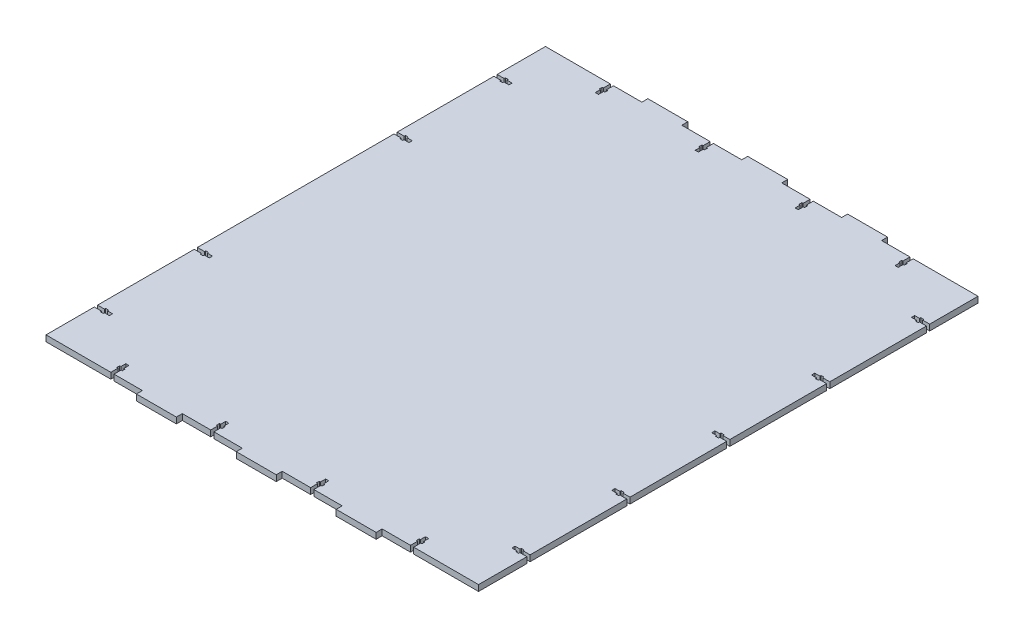
from build123d import *

# Parameters (mm, degrees)
SKETCH1_W           = 433
SKETCH1_H           = 500
BOSS_EXTRUDE1_DEPTH = 6
SKETCH2_W           = 40
SKETCH2_H           = 6
BOSS_EXTRUDE2_DEPTH = 6
CUT_EXTRUDE1_DEPTH  = 336.327079133


with BuildPart() as part:
    # Sketch1 → Boss-Extrude1 (new body)
    with BuildSketch(Plane(origin=(0, 0, 0), x_dir=(1, 0, 0), z_dir=(0, 1, 0))):
        Rectangle(SKETCH1_W, SKETCH1_H)
    extrude(amount=BOSS_EXTRUDE1_DEPTH)

    # Sketch2 → Boss-Extrude2 (add)
    with BuildSketch(Plane.XZ):
        with Locations((-100, 253)):
            Rectangle(SKETCH2_W, SKETCH2_H)
        with Locations((0, 253)):
            Rectangle(SKETCH2_W, SKETCH2_H)
        with Locations((100, 253)):
            Rectangle(SKETCH2_W, SKETCH2_H)
        with Locations((100, -253)):
            Rectangle(SKETCH2_W, SKETCH2_H)
        with Locations((0, -253)):
            Rectangle(SKETCH2_W, SKETCH2_H)
        with Locations((-100, -253)):
            Rectangle(SKETCH2_W, SKETCH2_H)
    extrude(amount=-BOSS_EXTRUDE2_DEPTH)

    # Sketch3 → Cut-Extrude1 (cut, through all)
    with BuildSketch(Plane.XZ):
        Polygon((-151.6, -243), (-151.6, -250), (-148.4, -250), (-148.4, -243), (-147.2, -243), (-147.2, -240), (-148.4, -240), (-148.4, -235), (-151.6, -235), (-151.6, -240), (-152.8, -240), (-152.8, -243), align=None)
        Polygon((-148.4, 250), (-151.6, 250), (-151.6, 243), (-152.8, 243), (-152.8, 240), (-151.6, 240), (-151.6, 235), (-148.4, 235), (-148.4, 240), (-147.2, 240), (-147.2, 243), (-148.4, 243), align=None)
        Polygon((-216.5, 201.6), (-216.5, 198.4), (-209.5, 198.4), (-209.5, 197.2), (-206.5, 197.2), (-206.5, 198.4), (-201.5, 198.4), (-201.5, 201.6), (-206.5, 201.6), (-206.5, 202.8), (-209.5, 202.8), (-209.5, 201.6), align=None)
        Polygon((-216.5, 101.6), (-216.5, 98.4), (-209.5, 98.4), (-209.5, 97.2), (-206.5, 97.2), (-206.5, 98.4), (-201.5, 98.4), (-201.5, 101.6), (-206.5, 101.6), (-206.5, 102.8), (-209.5, 102.8), (-209.5, 101.6), align=None)
        Polygon((-216.5, -98.4), (-216.5, -101.6), (-209.5, -101.6), (-209.5, -102.8), (-206.5, -102.8), (-206.5, -101.6), (-201.5, -101.6), (-201.5, -98.4), (-206.5, -98.4), (-206.5, -97.2), (-209.5, -97.2), (-209.5, -98.4), align=None)
        Polygon((-206.5, -201.6), (-201.5, -201.6), (-201.5, -198.4), (-206.5, -198.4), (-206.5, -197.2), (-209.5, -197.2), (-209.5, -198.4), (-216.5, -198.4), (-216.5, -201.6), (-209.5, -201.6), (-209.5, -202.8), (-206.5, -202.8), align=None)
        Polygon((151.6, 243), (151.6, 250), (148.4, 250), (148.4, 243), (147.2, 243), (147.2, 240), (148.4, 240), (148.4, 235), (151.6, 235), (151.6, 240), (152.8, 240), (152.8, 243), align=None)
        Polygon((148.4, -250), (151.6, -250), (151.6, -243), (152.8, -243), (152.8, -240), (151.6, -240), (151.6, -235), (148.4, -235), (148.4, -240), (147.2, -240), (147.2, -243), (148.4, -243), align=None)
        Polygon((216.5, -201.6), (216.5, -198.4), (209.5, -198.4), (209.5, -197.2), (206.5, -197.2), (206.5, -198.4), (201.5, -198.4), (201.5, -201.6), (206.5, -201.6), (206.5, -202.8), (209.5, -202.8), (209.5, -201.6), align=None)
        Polygon((216.5, -101.6), (216.5, -98.4), (209.5, -98.4), (209.5, -97.2), (206.5, -97.2), (206.5, -98.4), (201.5, -98.4), (201.5, -101.6), (206.5, -101.6), (206.5, -102.8), (209.5, -102.8), (209.5, -101.6), align=None)
        Polygon((216.5, -1.6), (216.5, 1.6), (209.5, 1.6), (209.5, 2.8), (206.5, 2.8), (206.5, 1.6), (201.5, 1.6), (201.5, -1.6), (206.5, -1.6), (206.5, -2.8), (209.5, -2.8), (209.5, -1.6), align=None)
        Polygon((216.5, 98.4), (216.5, 101.6), (209.5, 101.6), (209.5, 102.8), (206.5, 102.8), (206.5, 101.6), (201.5, 101.6), (201.5, 98.4), (206.5, 98.4), (206.5, 97.2), (209.5, 97.2), (209.5, 98.4), align=None)
        Polygon((206.5, 202.8), (206.5, 201.6), (201.5, 201.6), (201.5, 198.4), (206.5, 198.4), (206.5, 197.2), (209.5, 197.2), (209.5, 198.4), (216.5, 198.4), (216.5, 201.6), (209.5, 201.6), (209.5, 202.8), align=None)
        Polygon((-48.4, -235), (-51.6, -235), (-51.6, -240), (-52.8, -240), (-52.8, -243), (-51.6, -243), (-51.6, -250), (-48.4, -250), (-48.4, -243), (-47.2, -243), (-47.2, -240), (-48.4, -240), align=None)
        Polygon((51.6, -235), (48.4, -235), (48.4, -240), (47.2, -240), (47.2, -243), (48.4, -243), (48.4, -250), (51.6, -250), (51.6, -243), (52.8, -243), (52.8, -240), (51.6, -240), align=None)
        Polygon((51.6, 235), (51.6, 240), (52.8, 240), (52.8, 243), (51.6, 243), (51.6, 250), (48.4, 250), (48.4, 243), (47.2, 243), (47.2, 240), (48.4, 240), (48.4, 235), align=None)
        Polygon((-48.4, 235), (-48.4, 240), (-47.2, 240), (-47.2, 243), (-48.4, 243), (-48.4, 250), (-51.6, 250), (-51.6, 243), (-52.8, 243), (-52.8, 240), (-51.6, 240), (-51.6, 235), align=None)
    extrude(amount=-CUT_EXTRUDE1_DEPTH, mode=Mode.SUBTRACT)


solid = part.part
